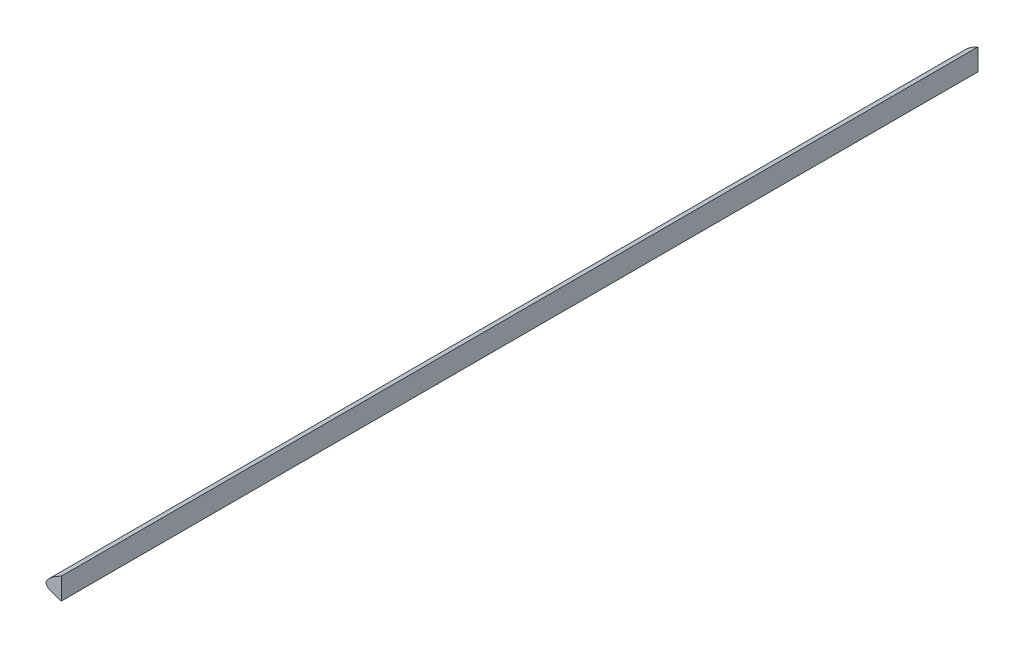
from build123d import *

# Parameters (mm, degrees)
BOSS_EXTRUDE2_DEPTH = 761.999746
CUT_EXTRUDE1_START  = -761.999746
CUT_EXTRUDE1_DEPTH  = 761.999746


# Read off the part's stored shape, not the designer's step: Cut-Extrude1
with BuildPart() as part:
    # Sketch2 → Boss-Extrude2 (new body)
    with BuildSketch(Plane.XY):
        with BuildLine():
            add(Edge.make_bspline(
                [(324.902693551, 0), (324.903463196, 0.023313358), (322.493960125, 0.266874853), (320.107118726, 0.728898482), (314.479929879, 1.696599545), (307.761979309, 2.966510847), (299.156213966, 4.44402059), (289.108994082, 6.054587212), (277.614504557, 7.858625418), (264.867967682, 9.828639283), (251.037893607, 11.946456865), (236.320520328, 14.162828682), (220.915494029, 16.434797842), (205.033677241, 18.716292105), (188.883341887, 20.922988597), (172.682407247, 22.997310524), (156.622614565, 24.830178487), (140.850407651, 26.262579625), (125.478771128, 27.205045845), (110.596641232, 27.609413226), (96.285303339, 27.444653165), (82.616452357, 26.722177249), (69.668434964, 25.464252485), (57.528852266, 23.789075325), (46.305668853, 21.755773795), (36.112498821, 19.421560607), (27.045487678, 16.846978605), (19.196955025, 14.082419467), (12.619518254, 11.195340149), (7.393829249, 8.273577005), (3.466455599, 5.362609604), (1.07214418, 2.697450283), (-0.443018312, -0.016380309), (1.142123289, -2.660381571), (4.36503606, -4.226764571), (8.971221404, -6.028809419), (15.243598774, -7.49562747), (23.03205608, -8.813433078), (32.324829104, -9.885015211), (43.025610851, -10.722004925), (55.037019029, -11.32133074), (68.234402161, -11.683120574), (82.476890937, -11.821694636), (97.60585357, -11.731263556), (113.468681032, -11.414630367), (129.930020513, -10.79847052), (146.859715047, -9.938801137), (164.102555428, -8.954688629), (181.455347718, -7.914187903), (198.694582839, -6.86098311), (215.596359861, -5.836960409), (231.942646987, -4.863457625), (247.517899408, -3.967162621), (262.118380872, -3.157120583), (275.542852028, -2.445675428), (287.622696903, -1.835678138), (298.158964313, -1.306811978), (307.16541669, -0.826816664), (314.173983408, -0.368946975), (319.99978897, -0.117218531), (322.45689994, 0.039112512), (324.901921434, -0.023388259), (324.902693551, 0)],
                knots=[0, 0, 0, 0, 0.001748082, 0.006827365, 0.014880219, 0.025572325, 0.038694157, 0.05417078, 0.071834092, 0.091434533, 0.112684614, 0.135293129, 0.158943981, 0.183314993, 0.208069947, 0.232879416, 0.257398767, 0.281383633, 0.304705763, 0.327241497, 0.348896563, 0.36960694, 0.389308376, 0.407885696, 0.425177149, 0.44102679, 0.455299972, 0.467903885, 0.478751648, 0.487814349, 0.495090031, 0.500616983, 0.504451368, 0.507803776, 0.513091193, 0.520546229, 0.530249123, 0.542213645, 0.556382479, 0.572655502, 0.590894529, 0.610925387, 0.632535859, 0.655496365, 0.679547083, 0.704498569, 0.730211425, 0.756435525, 0.782836661, 0.80906245, 0.834775916, 0.859641281, 0.883337827, 0.905540839, 0.925965139, 0.944326313, 0.960365877, 0.973929438, 0.984907697, 0.99311134, 0.998246302, 1, 1, 1, 1], degree=3))
        make_face()
    extrude(amount=-BOSS_EXTRUDE2_DEPTH)

    # Cut-Extrude1 outline → Cut-Extrude1 (cut)
    with BuildSketch(Plane.XY.offset(CUT_EXTRUDE1_START)):
        with BuildLine():
            add(Edge.make_bspline(
                [(324.902693551, 0), (324.903463196, 0.023313358), (322.493960125, 0.266874853), (320.107118726, 0.728898482), (314.479929879, 1.696599545), (307.761979309, 2.966510847), (299.156213966, 4.44402059), (289.108994082, 6.054587212), (277.614504557, 7.858625418), (264.867967682, 9.828639283), (251.037893607, 11.946456865), (236.320520328, 14.162828682), (220.915494029, 16.434797842), (205.033677241, 18.716292105), (188.883341887, 20.922988597), (172.682407247, 22.997310524), (156.622614565, 24.830178487), (140.850407651, 26.262579625), (125.478771128, 27.205045845), (110.596641232, 27.609413226), (96.285303339, 27.444653165), (82.616452357, 26.722177249), (69.668434964, 25.464252485), (57.528852266, 23.789075325), (46.305668853, 21.755773795), (36.112498821, 19.421560607), (27.045487678, 16.846978605), (19.3313577, 14.129761328), (14.714314762, 12.114502523), (12.7, 11.117087729)],
                knots=[0, 0, 0, 0, 0.001748082, 0.006827365, 0.014880219, 0.025572325, 0.038694157, 0.05417078, 0.071834092, 0.091434533, 0.112684614, 0.135293129, 0.158943981, 0.183314993, 0.208069947, 0.232879416, 0.257398767, 0.281383633, 0.304705763, 0.327241497, 0.348896563, 0.36960694, 0.389308376, 0.407885696, 0.425177149, 0.44102679, 0.455299972, 0.467903885, 0.478105627, 0.478105627, 0.478105627, 0.478105627], degree=3))
            Line((12.7, 11.117087729), (12.7, -6.876035615))
            add(Edge.make_bspline(
                [(12.7, -6.876035615), (13.386291094, -7.033779246), (16.659123202, -7.735133954), (23.03205608, -8.813433078), (32.324829104, -9.885015211), (43.025610851, -10.722004925), (55.037019029, -11.32133074), (68.234402161, -11.683120574), (82.476890937, -11.821694636), (97.60585357, -11.731263556), (113.468681032, -11.414630367), (129.930020513, -10.79847052), (146.859715047, -9.938801137), (164.102555428, -8.954688629), (181.455347718, -7.914187903), (198.694582839, -6.86098311), (215.596359861, -5.836960409), (231.942646987, -4.863457625), (247.517899408, -3.967162621), (262.118380872, -3.157120583), (275.542852028, -2.445675428), (287.622696903, -1.835678138), (298.158964313, -1.306811978), (307.16541669, -0.826816664), (314.173983408, -0.368946975), (319.99978897, -0.117218531), (322.45689994, 0.039112512), (324.901921434, -0.023388259), (324.902693551, 0)],
                knots=[0.52705934, 0.52705934, 0.52705934, 0.52705934, 0.530249123, 0.542213645, 0.556382479, 0.572655502, 0.590894529, 0.610925387, 0.632535859, 0.655496365, 0.679547083, 0.704498569, 0.730211425, 0.756435525, 0.782836661, 0.80906245, 0.834775916, 0.859641281, 0.883337827, 0.905540839, 0.925965139, 0.944326313, 0.960365877, 0.973929438, 0.984907697, 0.99311134, 0.998246302, 1, 1, 1, 1], degree=3))
        make_face()
    extrude(amount=CUT_EXTRUDE1_DEPTH, mode=Mode.SUBTRACT)


solid = part.part
